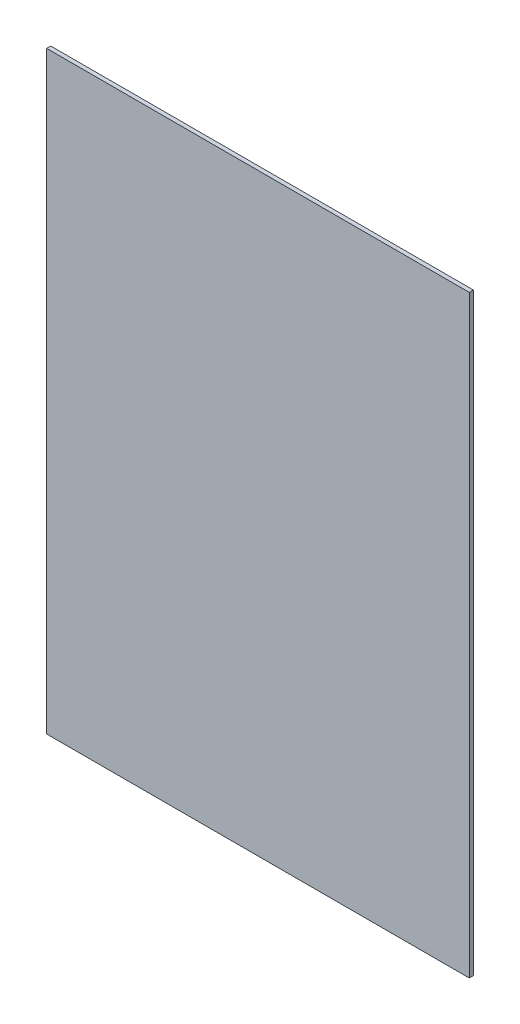
from build123d import *

# Parameters (mm, degrees)
SKETCH_1_W      = 620.3
SKETCH_1_H      = 871.6
EXTRUDE_1_DEPTH = 6


with BuildPart() as part:
    # Эскиз1 → Бобышка-Вытянуть1 (new body)
    with BuildSketch(Plane.XY):
        with Locations((-828.15, 0)):
            Rectangle(SKETCH_1_W, SKETCH_1_H)
    extrude(amount=-EXTRUDE_1_DEPTH)


solid = part.part
